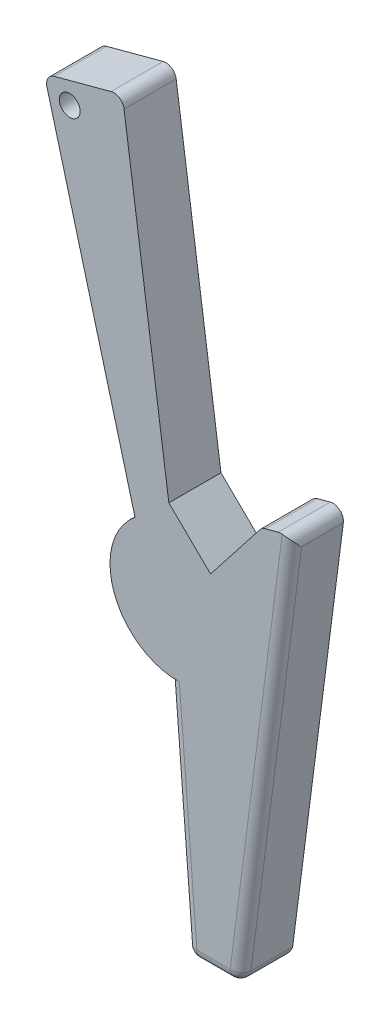
from build123d import *

# Parameters (mm, degrees)
BOSS_EXTRUDE1_DEPTH = 10
SKETCH5_R           = 2
CUT_EXTRUDE1_DEPTH  = 122.881115044
FILLET3_R           = 2
FILLET4_R           = 2


with BuildPart() as part:
    # Sketch3 → Boss-Extrude1 (new body)
    with BuildSketch(Plane.XY):
        with BuildLine():
            Line((-32.260936358, 25.087487365), (-47.260936358, 21.068249478))
            Line((-47.260936358, 21.068249478), (-29.84423885, -43.931750522))
            ThreePointArc((-29.84423885, -43.931750522), (-34.146547057, -57.548288053), (-23.353857896, -66.899106783))
            Line((-23.353857896, -66.899106783), (-19.821063106, -111.899106783))
            Line((-19.821063106, -111.899106783), (-9.821063106, -111.899106783))
            Line((-9.821063106, -111.899106783), (0.506029252, -31.899106783))
            Line((0.506029252, -31.899106783), (-5.493970748, -33.506801938))
            Line((-5.493970748, -33.506801938), (-15.353857896, -46.107699741))
            Line((-15.353857896, -46.107699741), (-23.353857896, -38.289669035))
            Line((-23.353857896, -38.289669035), (-32.260936358, 25.087487365))
        make_face()
    extrude(amount=BOSS_EXTRUDE1_DEPTH)

    # Sketch5 → Cut-Extrude1 (cut, through all)
    with BuildSketch(Plane.XY.offset(10)):
        with Locations((-42.361956872, 18.239822354)):
            Circle(SKETCH5_R)
    extrude(amount=-CUT_EXTRUDE1_DEPTH, mode=Mode.SUBTRACT)

    # Fillet3
    fillet3_edges = [part.edges().sort_by_distance(p)[0] for p in [
        (-14.821063106, -111.899106783, 0),
        (-21.587460501, -89.399106783, 0),
        (-5.493970748, -33.506801938, 5),
        (0.506029252, -31.899106783, 5),
        (-9.821063106, -111.899106783, 5),
        (-47.260936358, 21.068249478, 5),
        (-32.260936358, 25.087487365, 5),
        (-21.587460501, -89.399106783, 10),
        (-14.821063106, -111.899106783, 10),
        (-4.657516927, -71.899106783, 10),
    ]]
    fillet(fillet3_edges, radius=FILLET3_R)

    # Fillet4
    # the kernel refuses this fillet: 2 mm, written as the material it takes off along each edge
    with BuildSketch(Plane(origin=(-17.971922396, -109.899106783, 2), x_dir=(0, -1, 0), z_dir=(0, 0, -1))) as fillet4_piece_1_section:
        Polygon((0, 0), (FILLET4_R, 0), (FILLET4_R, FILLET4_R * 0.924570354696), (FILLET4_R * 0.0782657346199, FILLET4_R * 0.996932532714), align=None)
    fillet4_piece_1 = extrude(amount=FILLET4_R, mode=Mode.PRIVATE)
    fillet4_piece_1 = fillet4_piece_1 - Plane(origin=(-17.971922396, -109.899106783, 2), x_dir=(0.6788719560344534, 0.7342566767214005, 0), z_dir=(0, 0, -1)) * Sphere(FILLET4_R, mode=Mode.PRIVATE)
    add(fillet4_piece_1, mode=Mode.SUBTRACT)
    with BuildSketch(Plane(origin=(-17.971922396, -109.899106783, 8), x_dir=(0, -1, 0), z_dir=(0, 0, 1))) as fillet4_piece_2_section:
        Polygon((0, 0), (FILLET4_R, 0), (FILLET4_R, -FILLET4_R * 0.924570354696), (FILLET4_R * 0.0782657346199, -FILLET4_R * 0.996932532714), align=None)
    fillet4_piece_2 = extrude(amount=FILLET4_R, mode=Mode.PRIVATE)
    fillet4_piece_2 = fillet4_piece_2 - Plane(origin=(-17.971922396, -109.899106783, 8), x_dir=(0.6788719560344534, 0.7342566767214005, 0), z_dir=(0, 0, 1)) * Sphere(FILLET4_R, mode=Mode.PRIVATE)
    add(fillet4_piece_2, mode=Mode.SUBTRACT)
    with BuildSketch(Plane(origin=(-19.821063106, -111.899106783, 2), x_dir=(1, 0, 0), z_dir=(0, 0, 1))) as fillet4_piece_3:
        with BuildLine():
            CenterArc((FILLET4_R * 0.924570354696, FILLET4_R), FILLET4_R, 184.488887052, 85.511112948)
            Line((-FILLET4_R * 0.0723621780181, FILLET4_R * 0.92173426538), (0, 0))
            Line((0, 0), (FILLET4_R * 0.924570354696, 0))
        make_face()
    extrude(amount=6, mode=Mode.SUBTRACT)


solid = part.part
